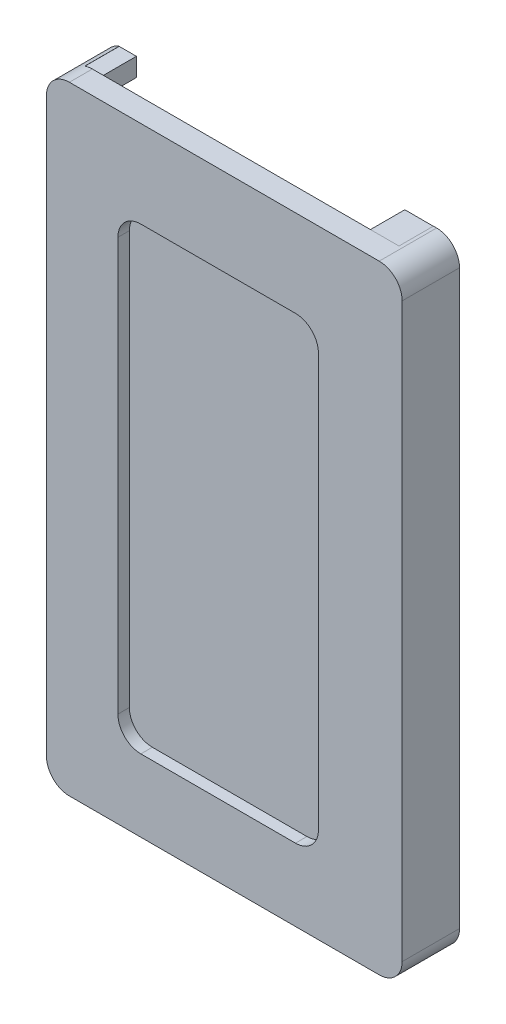
from build123d import *

# Parameters (mm, degrees)
SKETCH_5_W          = 31
SKETCH_5_H          = 53.868777402
SKETCH_5_W_2        = 27.381586342
SKETCH_5_H_2        = 50.42341648
EXTRUDE_3_DEPTH     = 3
SKETCH_8_W          = 15
SKETCH_8_H          = 1.581115617
CUT_EXTRUDE_6_DEPTH = 1
SKETCH_9_W          = 31
SKETCH_9_H          = 53.868777402
EXTRUDE_5_DEPTH     = 2
SKETCH_10_W         = 17.475002228
SKETCH_10_H         = 39.986467982
CUT_EXTRUDE_7_DEPTH = 1
FILLET_1_R          = 2
FILLET_2_R          = 2
SKETCH_11_W         = 27.381586342
SKETCH_11_H         = 3
CUT_EXTRUDE_8_DEPTH = 2
SKETCH_14_W         = 2.490628955
SKETCH_14_H         = 1.721797648
SKETCH_14_W_2       = 1.5
SKETCH_14_H_2       = 1.606542801
EXTRUDE_6_DEPTH     = 3


with BuildPart() as part:
    # 草图5 → 凸台-拉伸3 (new body)
    with BuildSketch(Plane.XY.offset(15)):
        with Locations((52.576231829, -51.822040042)):
            Rectangle(SKETCH_5_W, SKETCH_5_H)
        with Locations((52.104679946, -51.963604886)):
            Rectangle(SKETCH_5_W_2, SKETCH_5_H_2, mode=Mode.SUBTRACT)
    extrude(amount=EXTRUDE_3_DEPTH)

    # 草图8 → 切除-拉伸6 (cut)
    with BuildSketch(Plane(origin=(0, 0, 15), x_dir=(-1, 0, 0), z_dir=(0, 0, -1))):
        with Locations((-47.690080224, -77.965870935)):
            Rectangle(SKETCH_8_W, SKETCH_8_H)
    extrude(amount=-CUT_EXTRUDE_6_DEPTH, mode=Mode.SUBTRACT)

    # 草图9 → 凸台-拉伸5 (add)
    with BuildSketch(Plane.XY.offset(18)):
        with Locations((52.576231829, -51.822040042)):
            Rectangle(SKETCH_9_W, SKETCH_9_H)
    extrude(amount=EXTRUDE_5_DEPTH)

    # 草图10 → 切除-拉伸7 (cut)
    with BuildSketch(Plane.XY.offset(20)):
        with Locations((52.039568352, -52.470675496)):
            Rectangle(SKETCH_10_W, SKETCH_10_H)
    extrude(amount=-CUT_EXTRUDE_7_DEPTH, mode=Mode.SUBTRACT)

    # 圆角1
    fillet_1_edges = [part.edges().sort_by_distance(p)[0] for p in [
        (68.076231829, -78.756428743, 17.5),
        (37.076231829, -78.756428743, 17.5),
        (37.076231829, -24.887651341, 17.5),
        (68.076231829, -24.887651341, 17.5),
    ]]
    fillet(fillet_1_edges, radius=FILLET_1_R)

    # 圆角2
    fillet_2_edges = [part.edges().sort_by_distance(p)[0] for p in [
        (43.302067238, -72.463909487, 19.5),
        (60.777069466, -72.463909487, 19.5),
        (60.777069466, -32.477441505, 19.5),
        (43.302067238, -32.477441505, 19.5),
    ]]
    fillet(fillet_2_edges, radius=FILLET_2_R)

    # 草图11 → 切除-拉伸8 (cut)
    with BuildSketch(Plane(origin=(0, -26.751896646, 0), x_dir=(-1, 0, 0), z_dir=(0, -1, 0))):
        with Locations((-52.104679946, -16.5)):
            Rectangle(SKETCH_11_W, SKETCH_11_H)
    extrude(amount=-CUT_EXTRUDE_8_DEPTH, mode=Mode.SUBTRACT)

    # 草图14 → 凸台-拉伸6 (add)
    with BuildSketch(Plane(origin=(0, 0, 18), x_dir=(-1, 0, 0), z_dir=(0, 0, -1))):
        with Locations((-64.550158639, -25.755243126)):
            Rectangle(SKETCH_14_W, SKETCH_14_H)
        with Locations((-39.163886775, -25.81287055)):
            Rectangle(SKETCH_14_W_2, SKETCH_14_H_2)
    extrude(amount=EXTRUDE_6_DEPTH)


solid = part.part
